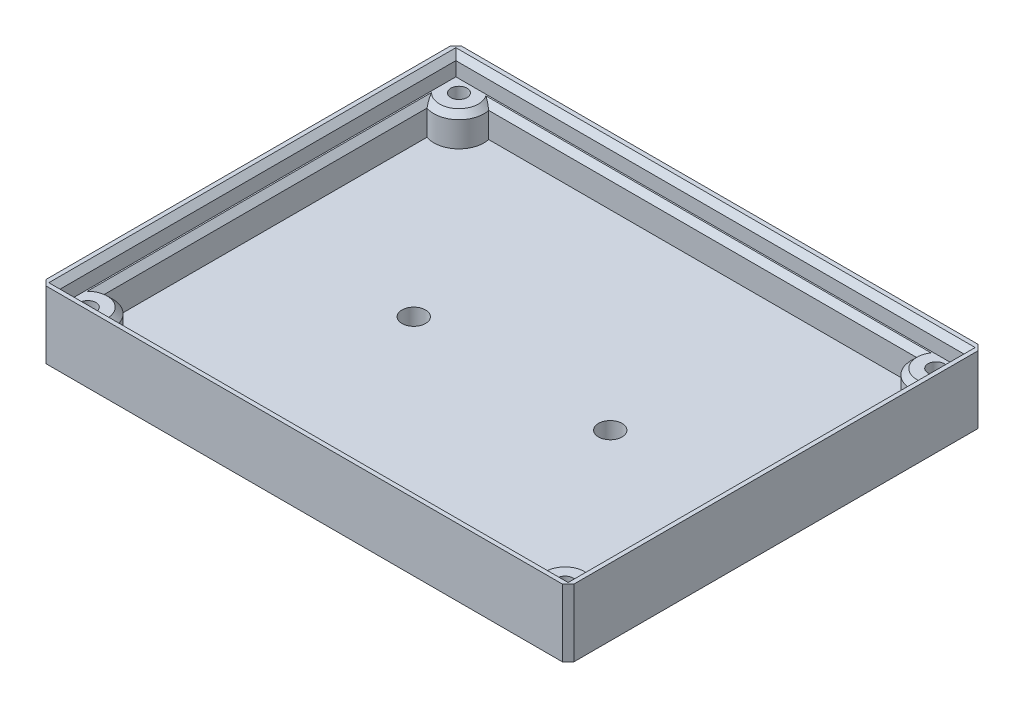
from build123d import *

# Parameters (mm, degrees)
SKETCH1_W           = 94
SKETCH1_H           = 74
BOSS_EXTRUDE1_DEPTH = 12
SKETCH2_W           = 90.5
SKETCH2_H           = 70.5
CUT_EXTRUDE1_DEPTH  = 3.5
SKETCH3_R           = 1.45
CUT_EXTRUDE2_DEPTH  = 6
SHELL1_START        = 3
SHELL1_DEPTH        = 5.5
CHAMFER1_SIZE       = 1
CHAMFER2_SIZE       = 1
CHAMFER3_SIZE       = 1
SKETCH4_R           = 2.1
CUT_EXTRUDE3_DEPTH  = 61.489668539


# Read off the part's stored shape, not the designer's step: Shell1
with BuildPart() as part:
    # Sketch1 → Boss-Extrude1 (new body)
    with BuildSketch(Plane(origin=(0, 0, 0), x_dir=(1, 0, 0), z_dir=(0, 1, 0))):
        Rectangle(SKETCH1_W, SKETCH1_H)
    extrude(amount=BOSS_EXTRUDE1_DEPTH)

    # Sketch2 → Cut-Extrude1 (cut)
    with BuildSketch(Plane(origin=(0, 12, 0), x_dir=(1, 0, 0), z_dir=(0, 1, 0))):
        Rectangle(SKETCH2_W, SKETCH2_H)
    extrude(amount=-CUT_EXTRUDE1_DEPTH, mode=Mode.SUBTRACT)

    # Sketch3 → Cut-Extrude2 (cut)
    with BuildSketch(Plane(origin=(0, 8.5, 0), x_dir=(1, 0, 0), z_dir=(0, 1, 0))):
        with Locations(Location((-42.5, 33.055555556, 0), (0, 0, 270))):
            Circle(SKETCH3_R)
        with Locations(Location((42.5, 33.055555556, 0), (0, 0, 270))):
            Circle(SKETCH3_R)
        with Locations(Location((42.5, -33.055555556, 0), (0, 0, 270))):
            Circle(SKETCH3_R)
        with Locations(Location((-42.5, -33.055555556, 0), (0, 0, 270))):
            Circle(SKETCH3_R)
    extrude(amount=-CUT_EXTRUDE2_DEPTH, mode=Mode.SUBTRACT)

    # Shell1 outline → Shell1 (cut)
    with BuildSketch(Plane(origin=(0, 0, 0), x_dir=(1, 0, 0), z_dir=(0, 1, 0)).offset(SHELL1_START)):
        with BuildLine():
            Line((-38.15137669, -34), (38.15137669, -34))
            ThreePointArc((38.15137669, -34), (39.564324481, -29.711260526), (44, -28.865985172))
            Line((44, -28.865985172), (44, 28.865985172))
            ThreePointArc((44, 28.865985172), (39.564324481, 29.711260526), (38.15137669, 34))
            Line((38.15137669, 34), (-38.15137669, 34))
            ThreePointArc((-38.15137669, 34), (-39.564324481, 29.711260526), (-44, 28.865985172))
            Line((-44, 28.865985172), (-44, -28.865985172))
            ThreePointArc((-44, -28.865985172), (-39.564324481, -29.711260526), (-38.15137669, -34))
        make_face()
    extrude(amount=SHELL1_DEPTH, mode=Mode.SUBTRACT)

    # Chamfer1
    chamfer1_edges = [part.edges().sort_by_distance(p)[0] for p in [
        (45.25, 12, 0),
        (0, 12, -35.25),
        (-45.25, 12, 0),
        (0, 12, 35.25),
    ]]
    chamfer(chamfer1_edges, length=CHAMFER1_SIZE)

    # Chamfer2
    chamfer2_edges = [part.edges().sort_by_distance(p)[0] for p in [
        (0, 8.5, 34),
        (44, 8.5, 0),
        (0, 8.5, -34),
        (-44, 8.5, 0),
        (-39.564324481, 8.5, -29.711260526),
        (39.564324481, 8.5, -29.711260526),
        (39.564324481, 8.5, 29.711260526),
        (-39.564324481, 8.5, 29.711260526),
    ]]
    chamfer(chamfer2_edges, length=CHAMFER2_SIZE)

    # Chamfer3
    chamfer3_edges = [part.edges().sort_by_distance(p)[0] for p in [
        (-47, 6, 37),
        (-47, 6, -37),
        (47, 6, -37),
        (47, 6, 37),
    ]]
    chamfer(chamfer3_edges, length=CHAMFER3_SIZE)

    # Sketch4 → Cut-Extrude3 (cut, through all)
    with BuildSketch(Plane(origin=(0, 3, 0), x_dir=(1, 0, 0), z_dir=(0, 1, 0))):
        with Locations(Location((-17.5, 0, 0), (0, 0, 270))):
            Circle(SKETCH4_R)
        with Locations(Location((17.5, 0, 0), (0, 0, 270))):
            Circle(SKETCH4_R)
    extrude(amount=-CUT_EXTRUDE3_DEPTH, mode=Mode.SUBTRACT)


solid = part.part
